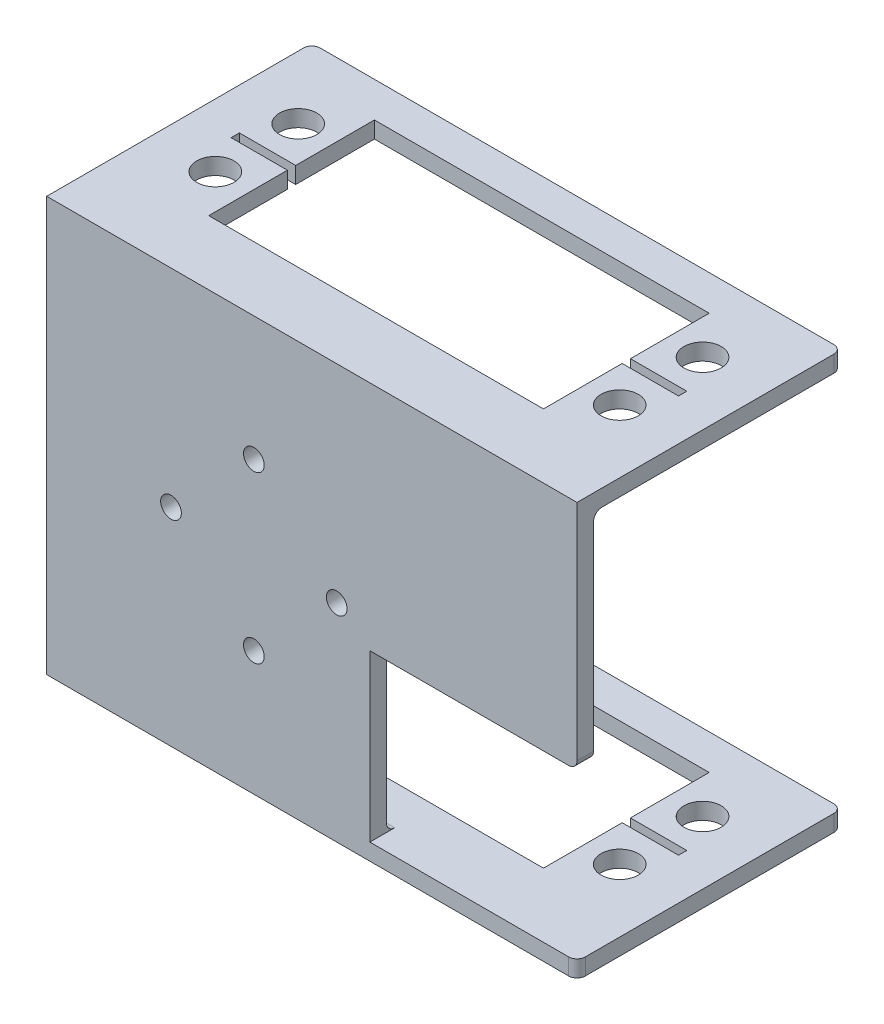
from build123d import *

# Parameters (mm, degrees)
SKETCH1_W               = 100
SKETCH1_H               = 32
BOSS_EXTRUDE1_DEPTH     = 2
SKETCH2_W               = 100
SKETCH2_H               = 2
BOSS_EXTRUDE2_DEPTH     = 46
SKETCH3_W               = 100
SKETCH3_H               = 2
BOSS_EXTRUDE3_DEPTH     = 32
CUT_EXTRUDE1_DEPTH      = 117.292734081
CUT_EXTRUDE1_DEPTH_BACK = 117.292734081
SKETCH4_R               = 2.25
CUT_EXTRUDE2_DEPTH      = 117.292734081
CUT_EXTRUDE2_DEPTH_BACK = 117.292734081
SKETCH6_W               = 25
SKETCH6_H               = 20
CUT_EXTRUDE3_DEPTH      = 2
FILLET1_R               = 1
M3_TAPPED_HOLE1_D       = 2.5


with BuildPart() as part:
    # Sketch1 → Boss-Extrude1 (new body)
    with BuildSketch(Plane(origin=(0, 0, 0), x_dir=(1, 0, 0), z_dir=(0, 1, 0))):
        with Locations((50, 16)):
            Rectangle(SKETCH1_W, SKETCH1_H)
    extrude(amount=BOSS_EXTRUDE1_DEPTH)

    # Sketch2 → Boss-Extrude2 (add)
    with BuildSketch(Plane.XZ):
        with Locations((50, -1)):
            Rectangle(SKETCH2_W, SKETCH2_H)
    extrude(amount=BOSS_EXTRUDE2_DEPTH)

    # Sketch3 → Boss-Extrude3 (add)
    with BuildSketch(Plane.XY):
        with Locations((50, -47)):
            Rectangle(SKETCH3_W, SKETCH3_H)
    extrude(amount=-BOSS_EXTRUDE3_DEPTH)

    # Sketch4 → Cut-Extrude1 (cut, two sides: drawn at the far end of the back side and taken through both)
    with BuildSketch(Plane(origin=(0, 2, 0), x_dir=(1, 0, 0), z_dir=(0, 1, 0)).offset(-CUT_EXTRUDE1_DEPTH_BACK)):
        with Locations((7.6, 22.75)):
            Circle(SKETCH4_R)
        with Locations((56.4, 22.75)):
            Circle(SKETCH4_R)
        with Locations((56.4, 12.75)):
            Circle(SKETCH4_R)
        Polygon((52.2, 18.25), (52.2, 27.75), (11.8, 27.75), (11.8, 18.25), (5, 18.25), (5, 17.25), (11.8, 17.25), (11.8, 7.75), (52.2, 7.75), (52.2, 17.25), (59, 17.25), (59, 18.25), align=None)
        with Locations((7.6, 12.75)):
            Circle(SKETCH4_R)
    extrude(amount=CUT_EXTRUDE1_DEPTH + CUT_EXTRUDE1_DEPTH_BACK, mode=Mode.SUBTRACT)

    # Sketch5 → Cut-Extrude2 (cut, two sides: drawn at the far end of the back side and taken through both)
    with BuildSketch(Plane.XZ.offset(48).offset(-CUT_EXTRUDE2_DEPTH_BACK)):
        Polygon((64, -17.75), (64, -32), (100, -32), (100, 0), (64, 0), align=None)
    extrude(amount=CUT_EXTRUDE2_DEPTH + CUT_EXTRUDE2_DEPTH_BACK, mode=Mode.SUBTRACT)

    # Sketch6 → Cut-Extrude3 (cut)
    with BuildSketch(Plane(origin=(0, 0, -2), x_dir=(-1, 0, 0), z_dir=(0, 0, -1))):
        with Locations((-51.5, -36)):
            Rectangle(SKETCH6_W, SKETCH6_H)
    extrude(amount=-CUT_EXTRUDE3_DEPTH, mode=Mode.SUBTRACT)

    # Fillet1
    fillet1_edges = [part.edges().sort_by_distance(p)[0] for p in [
        (0, 1, -32),
        (0, -47, -32),
        (64, -47, -32),
        (64, 1, -32),
        (32, 0, -2),
        (19.5, -46, -2),
        (64, -47, 0),
        (64, -26, -1),
    ]]
    fillet(fillet1_edges, radius=FILLET1_R)

    # M3 Tapped Hole1 (through all)
    with Locations(Plane(origin=(25, -13, -2), x_dir=(-1, 0, 0), z_dir=(0, 0, -1))):
        with Locations((0, 0), (-10, -10), (0, -20), (10, -10)):
            Hole(M3_TAPPED_HOLE1_D / 2)


solid = part.part
